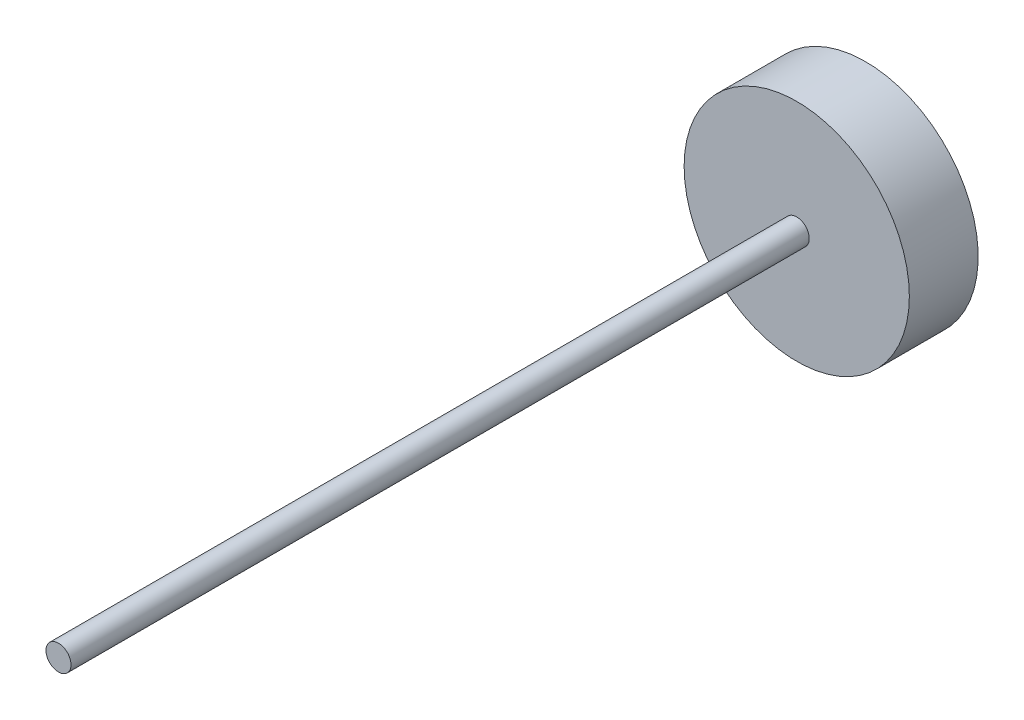
from build123d import *

# Parameters (mm, degrees)
SKETCH1_R                = 88
BOSS_EXTRUDE3_DEPTH      = 25
SKETCH4_W                = 10.4719
SKETCH4_H                = 13.351164338
BOSS_EXTRUDE4_DEPTH      = 25
FILLET2_R                = 4
CIRPATTERN1_COUNT        = 30
FILLET2_OF_CIRPATTERN1_R = 4
SKETCH6_R                = 10
BOSS_EXTRUDE5_DEPTH      = 60
BOSS_EXTRUDE6_START      = 10
SKETCH7_R                = 10
BOSS_EXTRUDE6_DEPTH      = 10
SKETCH8_R                = 10
BOSS_EXTRUDE7_DEPTH      = 10
SKETCH9_R                = 10
BOSS_EXTRUDE8_DEPTH      = 25
SKETCH10_R               = 10
BOSS_EXTRUDE9_DEPTH      = 42.5
SKETCH12_R               = 12.5
CUT_EXTRUDE1_DEPTH       = 12
CUT_EXTRUDE2_START       = -55.5
SKETCH13_R               = 10
CUT_EXTRUDE2_DEPTH       = 55.5
SKETCH14_R               = 10
BOSS_EXTRUDE10_DEPTH     = 440
SKETCH15_R               = 105
BOSS_EXTRUDE12_DEPTH     = 25
BOSS_EXTRUDE13_START     = 30
SKETCH16_R               = 105
BOSS_EXTRUDE13_DEPTH     = 30
SKETCH17_R               = 10
BOSS_EXTRUDE14_DEPTH     = 50
SKETCH18_R               = 10
BOSS_EXTRUDE15_DEPTH     = 30
SKETCH19_R               = 105
SKETCH19_R_2             = 90
CUT_EXTRUDE3_DEPTH       = 100
SHELL3_START             = -30
SHELL3_OUTLINE_R         = 80
SHELL3_DEPTH             = 45
SCALE2_SCALE             = 0.2


# Read off the part's stored shape, not the designer's step: Shell3
with BuildPart() as part:
    # Sketch1 → Boss-Extrude3 (new body)
    with BuildSketch(Plane.XY):
        Circle(SKETCH1_R)
    extrude(amount=BOSS_EXTRUDE3_DEPTH)

    # Sketch4 → Boss-Extrude4 (add)
    with BuildSketch(Plane.XY.offset(25)):
        with Locations((0, 93.324417831)):
            Rectangle(SKETCH4_W, SKETCH4_H)
    boss_extrude4 = extrude(amount=-BOSS_EXTRUDE4_DEPTH)

    # Fillet2
    fillet2_edges = [part.edges().sort_by_distance(p)[0] for p in [
        (5.23595, 100, 12.5),
        (0, 100, 0),
        (-5.23595, 100, 12.5),
        (0, 100, 25),
    ]]
    fillet(fillet2_edges, radius=FILLET2_R)

    # CirPattern1: Boss-Extrude4 ×30 about axis
    cirpattern1_axis = Axis((0, 0.317667884, 0), (0, 0, 1))
    for i in range(1, CIRPATTERN1_COUNT):
        add(boss_extrude4.rotate(cirpattern1_axis, i * 360 / CIRPATTERN1_COUNT))

    # Fillet2 of CirPattern1
    fillet2_of_cirpattern1_edges = [part.edges().sort_by_distance(p)[0] for p in [
        (-15.603590285, 98.910317096, 12.5),
        (-20.725122215, 97.821701879, 0),
        (-25.846654145, 96.733086661, 12.5),
        (-20.725122215, 97.821701879, 25),
        (-35.7611788, 93.511662322, 12.5),
        (-40.544457139, 91.382009596, 0),
        (-45.327735478, 89.252356869, 12.5),
        (-40.544457139, 91.382009596, 25),
        (-54.3558322, 84.039982796, 12.5),
        (-58.591804732, 80.962368605, 0),
        (-62.827777264, 77.884754413, 12.5),
        (-58.591804732, 80.962368605, 25),
        (-70.574874905, 70.909236365, 12.5),
        (-74.078409304, 67.018167216, 0),
        (-77.581943702, 63.127098067, 12.5),
        (-74.078409304, 67.018167216, 25),
        (-83.709456921, 54.693299655, 12.5),
        (-86.327431921, 50.158833942, 0),
        (-88.945406921, 45.624368229, 12.5),
        (-86.327431921, 50.158833942, 25),
        (-93.185533987, 36.100886913, 12.5),
        (-94.803531519, 31.121202547, 0),
        (-96.42152905, 26.14151818, 12.5),
        (-94.803531519, 31.121202547, 25),
        (-98.588956064, 15.944575793, 12.5),
        (-99.136261871, 10.737308875, 0),
        (-99.683567678, 5.530041957, 12.5),
        (-99.136261871, 10.737308875, 25),
        (-99.683567678, -4.894706189, 12.5),
        (-99.136261871, -10.101973107, 0),
        (-98.588956064, -15.309240025, 12.5),
        (-99.136261871, -10.101973107, 25),
        (-96.42152905, -25.506182413, 12.5),
        (-94.803531519, -30.485866779, 0),
        (-93.185533987, -35.465551145, 12.5),
        (-94.803531519, -30.485866779, 25),
        (-88.945406921, -44.989032461, 12.5),
        (-86.327431921, -49.523498174, 0),
        (-83.709456921, -54.057963887, 12.5),
        (-86.327431921, -49.523498174, 25),
        (-77.581943702, -62.491762299, 12.5),
        (-74.078409304, -66.382831448, 0),
        (-70.574874905, -70.273900597, 12.5),
        (-74.078409304, -66.382831448, 25),
        (-62.827777264, -77.249418645, 12.5),
        (-58.591804732, -80.327032837, 0),
        (-54.3558322, -83.404647029, 12.5),
        (-58.591804732, -80.327032837, 25),
        (-45.327735478, -88.617021102, 12.5),
        (-40.544457139, -90.746673828, 0),
        (-35.7611788, -92.876326554, 12.5),
        (-40.544457139, -90.746673828, 25),
        (-25.846654145, -96.097750894, 12.5),
        (-20.725122215, -97.186366111, 0),
        (-15.603590285, -98.274981329, 12.5),
        (-20.725122215, -97.186366111, 25),
        (-5.23595, -99.364664232, 12.5),
        (0, -99.364664232, 0),
        (5.23595, -99.364664232, 12.5),
        (0, -99.364664232, 25),
        (15.603590285, -98.274981329, 12.5),
        (20.725122215, -97.186366111, 0),
        (25.846654145, -96.097750894, 12.5),
        (20.725122215, -97.186366111, 25),
        (35.7611788, -92.876326554, 12.5),
        (40.544457139, -90.746673828, 0),
        (45.327735478, -88.617021102, 12.5),
        (40.544457139, -90.746673828, 25),
        (54.3558322, -83.404647029, 12.5),
        (58.591804732, -80.327032837, 0),
        (62.827777264, -77.249418645, 12.5),
        (58.591804732, -80.327032837, 25),
        (70.574874905, -70.273900597, 12.5),
        (74.078409304, -66.382831448, 0),
        (77.581943702, -62.491762299, 12.5),
        (74.078409304, -66.382831448, 25),
        (83.709456921, -54.057963887, 12.5),
        (86.327431921, -49.523498174, 0),
        (88.945406921, -44.989032461, 12.5),
        (86.327431921, -49.523498174, 25),
        (93.185533987, -35.465551145, 12.5),
        (94.803531519, -30.485866779, 0),
        (96.42152905, -25.506182413, 12.5),
        (94.803531519, -30.485866779, 25),
        (98.588956064, -15.309240025, 12.5),
        (99.136261871, -10.101973107, 0),
        (99.683567678, -4.894706189, 12.5),
        (99.136261871, -10.101973107, 25),
        (99.683567678, 5.530041957, 12.5),
        (99.136261871, 10.737308875, 0),
        (98.588956064, 15.944575793, 12.5),
        (99.136261871, 10.737308875, 25),
        (96.42152905, 26.14151818, 12.5),
        (94.803531519, 31.121202547, 0),
        (93.185533987, 36.100886913, 12.5),
        (94.803531519, 31.121202547, 25),
        (88.945406921, 45.624368229, 12.5),
        (86.327431921, 50.158833942, 0),
        (83.709456921, 54.693299655, 12.5),
        (86.327431921, 50.158833942, 25),
        (77.581943702, 63.127098067, 12.5),
        (74.078409304, 67.018167216, 0),
        (70.574874905, 70.909236365, 12.5),
        (74.078409304, 67.018167216, 25),
        (62.827777264, 77.884754413, 12.5),
        (58.591804732, 80.962368605, 0),
        (54.3558322, 84.039982796, 12.5),
        (58.591804732, 80.962368605, 25),
        (45.327735478, 89.252356869, 12.5),
        (40.544457139, 91.382009596, 0),
        (35.7611788, 93.511662322, 12.5),
        (40.544457139, 91.382009596, 25),
        (25.846654145, 96.733086661, 12.5),
        (20.725122215, 97.821701879, 0),
        (15.603590285, 98.910317096, 12.5),
        (20.725122215, 97.821701879, 25),
    ]]
    fillet(fillet2_of_cirpattern1_edges, radius=FILLET2_OF_CIRPATTERN1_R)

    # Sketch6 → Boss-Extrude5 (add)
    with BuildSketch(Plane.XY.offset(25)):
        Circle(SKETCH6_R)
    extrude(amount=BOSS_EXTRUDE5_DEPTH)

    # Sketch7 → Boss-Extrude6 (add)
    with BuildSketch(Plane(origin=(0, 0, 0), x_dir=(-1, 0, 0), z_dir=(0, 0, -1)).offset(BOSS_EXTRUDE6_START)):
        with Locations(Location((0, 0, 0), (0, 0, 180))):
            Circle(SKETCH7_R)
    extrude(amount=-BOSS_EXTRUDE6_DEPTH)

    # Sketch8 → Boss-Extrude7 (add)
    with BuildSketch(Plane.XY.offset(85)):
        Circle(SKETCH8_R)
    extrude(amount=BOSS_EXTRUDE7_DEPTH)

    # Sketch9 → Boss-Extrude8 (add)
    with BuildSketch(Plane.XY.offset(95)):
        Circle(SKETCH9_R)
    extrude(amount=BOSS_EXTRUDE8_DEPTH)

    # Sketch10 → Boss-Extrude9 (add)
    with BuildSketch(Plane.XY.offset(120)):
        Circle(SKETCH10_R)
    extrude(amount=BOSS_EXTRUDE9_DEPTH)

    # Sketch12 → Cut-Extrude1 (cut)
    with BuildSketch(Plane.XY.offset(162.5)):
        Circle(SKETCH12_R)
    extrude(amount=-CUT_EXTRUDE1_DEPTH, mode=Mode.SUBTRACT)

    # Sketch13 → Cut-Extrude2 (cut)
    with BuildSketch(Plane.XY.offset(150.5).offset(CUT_EXTRUDE2_START)):
        Circle(SKETCH13_R)
    extrude(amount=CUT_EXTRUDE2_DEPTH, mode=Mode.SUBTRACT)

    # Sketch14 → Boss-Extrude10 (add)
    with BuildSketch(Plane.XY.offset(95)):
        Circle(SKETCH14_R)
    extrude(amount=BOSS_EXTRUDE10_DEPTH)

    # Sketch15 → Boss-Extrude12 (add)
    with BuildSketch(Plane(origin=(0, 0, 0), x_dir=(-1, 0, 0), z_dir=(0, 0, -1))):
        Circle(SKETCH15_R)
    extrude(amount=-BOSS_EXTRUDE12_DEPTH)

    # Sketch16 → Boss-Extrude13 (add)
    with BuildSketch(Plane(origin=(0, 0, 0), x_dir=(-1, 0, 0), z_dir=(0, 0, -1)).offset(BOSS_EXTRUDE13_START)):
        Circle(SKETCH16_R)
    extrude(amount=-BOSS_EXTRUDE13_DEPTH)

    # Sketch17 → Boss-Extrude14 (add)
    with BuildSketch(Plane.XY.offset(535)):
        Circle(SKETCH17_R)
    extrude(amount=BOSS_EXTRUDE14_DEPTH)

    # Sketch18 → Boss-Extrude15 (add)
    with BuildSketch(Plane.XY.offset(585)):
        Circle(SKETCH18_R)
    extrude(amount=BOSS_EXTRUDE15_DEPTH)

    # Sketch19 → Cut-Extrude3 (cut)
    with BuildSketch(Plane(origin=(0, 0, -30), x_dir=(-1, 0, 0), z_dir=(0, 0, -1))):
        Circle(SKETCH19_R)
        Circle(SKETCH19_R_2, mode=Mode.SUBTRACT)
    extrude(amount=-CUT_EXTRUDE3_DEPTH, mode=Mode.SUBTRACT)

    # Shell3 outline → Shell3 (cut)
    with BuildSketch(Plane.XY.offset(SHELL3_START)):
        Circle(SHELL3_OUTLINE_R)
    extrude(amount=SHELL3_DEPTH, mode=Mode.SUBTRACT)


with BuildPart() as part_1:
    # Scale2: scaled about (0, 0, 92.038106236)
    add(part.part.scale(SCALE2_SCALE).moved(Location((0, 0, 73.630484989))))


solid = part_1.part
